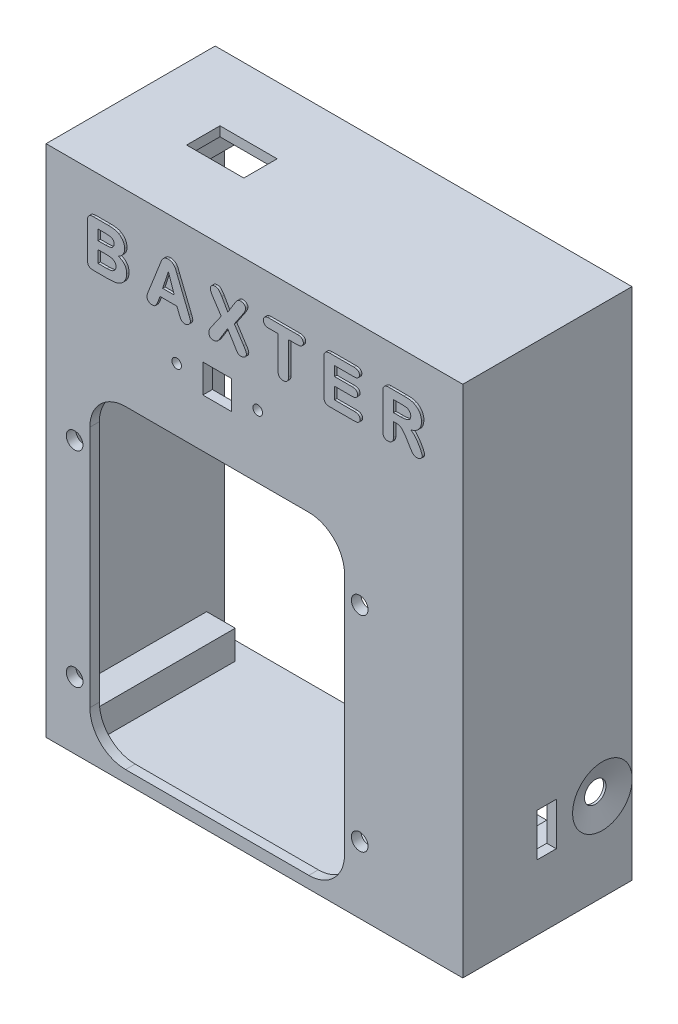
from build123d import *

# Parameters (mm, degrees)
SKETCH1_W           = 87.459125887
SKETCH1_H           = 107.911043217
SKETCH1_R           = 1.75
SKETCH1_R_2         = 1
SKETCH1_W_2         = 6
SKETCH1_H_2         = 6
BOSS_EXTRUDE1_DEPTH = 2
BOSS_EXTRUDE2_DEPTH = 0.5
SKETCH3_W           = 87.459125887
SKETCH3_H           = 107.911043217
SKETCH3_W_2         = 83.459125887
SKETCH3_H_2         = 103.911043217
BOSS_EXTRUDE3_DEPTH = 33.5
CUT_EXTRUDE1_REACH  = 126.747
SKETCH4_W           = 12
SKETCH4_H           = 7
CUT_EXTRUDE2_REACH  = 120.971
SKETCH5_W           = 4
SKETCH5_H           = 9
CUT_EXTRUDE3_REACH  = 119.509
SKETCH6_W           = 3.100406351
SKETCH6_H           = 3.267480843
CUT_EXTRUDE4_START  = -2
SKETCH7_R           = 2.252162883
CUT_EXTRUDE4_DEPTH  = 2
CHAMFER1_SIZE       = 1.5
CHAMFER1_SIZE_2     = 4
SKETCH8_W           = 6.466903759
SKETCH8_H           = 9.411043217
SKETCH8_R           = 1.5
SKETCH8_W_2         = 8
SKETCH8_H_2         = 8
SKETCH8_W_3         = 6
SKETCH8_H_3         = 6
BOSS_EXTRUDE4_DEPTH = 29.704377
CHAMFER2_SIZE       = 0.5


with BuildPart() as part:
    # Sketch1 → Boss-Extrude1 (new body)
    with BuildSketch(Plane.XY):
        with Locations((7.814562944, 18.465521609)):
            Rectangle(SKETCH1_W, SKETCH1_H)
        with Locations((-29.915, 21.5)):
            Circle(SKETCH1_R, mode=Mode.SUBTRACT)
        with Locations((-29.915, -21.5)):
            Circle(SKETCH1_R, mode=Mode.SUBTRACT)
        with Locations((29.915, -21.5)):
            Circle(SKETCH1_R, mode=Mode.SUBTRACT)
        with Locations((29.915, 21.5)):
            Circle(SKETCH1_R, mode=Mode.SUBTRACT)
        with Locations((8.5, 46.192098803)):
            Circle(SKETCH1_R_2, mode=Mode.SUBTRACT)
        with Locations((-8.5, 46.192098803)):
            Circle(SKETCH1_R_2, mode=Mode.SUBTRACT)
        with Locations((0, 46.192098803)):
            Rectangle(SKETCH1_W_2, SKETCH1_H_2, mode=Mode.SUBTRACT)
        with BuildLine():
            Line((-19.223311659, 32.99), (19.223311659, 32.99))
            ThreePointArc((19.223311659, 32.99), (24.526612518, 30.793300859), (26.723311659, 25.49))
            Line((26.723311659, 25.49), (26.723311659, -25.49))
            ThreePointArc((26.723311659, -25.49), (24.526612518, -30.793300859), (19.223311659, -32.99))
            Line((19.223311659, -32.99), (-19.223311659, -32.99))
            ThreePointArc((-19.223311659, -32.99), (-24.526612518, -30.793300859), (-26.723311659, -25.49))
            Line((-26.723311659, -25.49), (-26.723311659, 25.49))
            ThreePointArc((-26.723311659, 25.49), (-24.526612518, 30.793300859), (-19.223311659, 32.99))
        make_face(mode=Mode.SUBTRACT)
    extrude(amount=-BOSS_EXTRUDE1_DEPTH)

    # Sketch2 → Boss-Extrude2 (add)
    # profile 1 of 6: a face of its own
    with BuildSketch(Plane.XY):
        with BuildLine():
            Line((-22.527233932, 54.865073738), (-25.449108932, 54.865073738))
            add(Edge.make_bspline(
                [(-25.449108932, 54.865073738), (-25.504462753, 54.86651031), (-25.611432496, 54.869286445), (-25.766410869, 54.881712834), (-25.90933825, 54.907583848), (-26.040441654, 54.941783394), (-26.159295279, 54.987637572), (-26.266914842, 55.041221498), (-26.36189499, 55.106668517), (-26.473623858, 55.207124464), (-26.587002132, 55.366601638), (-26.682692574, 55.596581487), (-26.738187962, 55.869662535), (-26.744544319, 56.065325273), (-26.747937057, 56.169761238)],
                knots=[0, 0, 0, 0, 0.936955413, 1.810640645, 2.627471322, 3.391725116, 4.099592845, 4.779477373, 5.421161952, 6.045107732, 7.31426143, 8.691323709, 10.233977494, 12, 12, 12, 12], degree=3))
            Line((-26.747937057, 56.169761238), (-26.747937057, 63.310386238))
            add(Edge.make_bspline(
                [(-26.747937057, 63.310386238), (-26.746449444, 63.365079985), (-26.743558182, 63.471380532), (-26.731734098, 63.6251866), (-26.704428182, 63.766935954), (-26.673953366, 63.898231458), (-26.626631652, 64.016018594), (-26.576281463, 64.124941611), (-26.50948738, 64.218782667), (-26.437110862, 64.304692705), (-26.35268313, 64.379772969), (-26.255131133, 64.441176508), (-26.14926693, 64.498217682), (-26.029179426, 64.538588002), (-25.900582628, 64.575443514), (-25.759537082, 64.59705456), (-25.608384177, 64.614150788), (-25.503202956, 64.61476028), (-25.449108932, 64.615073738)],
                knots=[0, 0, 0, 0, 1.234281386, 2.398899174, 3.473276213, 4.488311567, 5.431895501, 6.33161106, 7.186973205, 8.019984934, 8.862648005, 9.722034222, 10.615255291, 11.567483617, 12.572055511, 13.629438883, 14.780835704, 16, 16, 16, 16], degree=3))
            Line((-25.449108932, 64.615073738), (-22.349499557, 64.615073738))
            add(Edge.make_bspline(
                [(-22.349499557, 64.615073738), (-22.233595609, 64.613950408), (-22.008157866, 64.611765488), (-21.68092858, 64.594908093), (-21.374649327, 64.563384617), (-21.089052601, 64.520700751), (-20.82125908, 64.466852852), (-20.574449843, 64.386672854), (-20.343350019, 64.293042834), (-20.202206593, 64.211747166), (-20.132702682, 64.171714363)],
                knots=[0, 0, 0, 0, 1.21529484, 2.363796318, 3.434321539, 4.442246558, 5.391526987, 6.293972514, 7.159892973, 8, 8, 8, 8], degree=3))
            add(Edge.make_bspline(
                [(-20.132702682, 64.171714363), (-20.06675251, 64.129947772), (-19.937704656, 64.048221087), (-19.761469092, 63.907127373), (-19.600176562, 63.760094436), (-19.459693943, 63.600053974), (-19.334216346, 63.434681158), (-19.226132115, 63.261242336), (-19.133934041, 63.081846225), (-19.059752571, 62.895160238), (-19.001582006, 62.704271864), (-18.957857023, 62.509899355), (-18.931668658, 62.311761208), (-18.928978037, 62.178302231), (-18.927624557, 62.111167488)],
                knots=[0, 0, 0, 0, 1.123942313, 2.199271674, 3.248046618, 4.264655283, 5.262745254, 6.236198248, 7.205302616, 8.165100739, 9.126501924, 10.077828096, 11.033077278, 12, 12, 12, 12], degree=3))
            add(Edge.make_bspline(
                [(-18.927624557, 62.111167488), (-18.931489245, 61.994315706), (-18.9390012, 61.767186089), (-19.004691021, 61.439964312), (-19.111911147, 61.139961084), (-19.2634151, 60.866734479), (-19.458079919, 60.620588957), (-19.698625232, 60.404983831), (-19.979552334, 60.214047875), (-20.189714457, 60.11543802), (-20.298718307, 60.064292488)],
                knots=[0, 0, 0, 0, 1.065910341, 2.071853786, 3.032604125, 3.963777757, 4.911515493, 5.883452176, 6.902219595, 8, 8, 8, 8], degree=3))
            add(Edge.make_bspline(
                [(-20.298718307, 60.064292488), (-20.225436378, 60.040565166), (-20.082424127, 59.994260466), (-19.878483622, 59.909254859), (-19.688265118, 59.81590001), (-19.512581481, 59.711862733), (-19.348712421, 59.600748824), (-19.200064013, 59.477939801), (-19.067489899, 59.343391167), (-18.944279865, 59.203409225), (-18.839546299, 59.050588815), (-18.748907148, 58.888098828), (-18.670495162, 58.717381001), (-18.608819666, 58.53562422), (-18.556629148, 58.345601851), (-18.522351202, 58.144775121), (-18.503205745, 57.934458723), (-18.499717675, 57.791545092), (-18.497937057, 57.718589363)],
                knots=[0, 0, 0, 0, 1.152771041, 2.249673079, 3.304543993, 4.322567291, 5.303956752, 6.266136403, 7.20345915, 8.12956584, 9.054235272, 9.970648562, 10.912823746, 11.862231084, 12.841051902, 13.860194419, 14.907654394, 16, 16, 16, 16], degree=3))
            add(Edge.make_bspline(
                [(-18.497937057, 57.718589363), (-18.502438125, 57.587304693), (-18.511321881, 57.328188274), (-18.5937821, 56.948471725), (-18.722375131, 56.584732045), (-18.872788728, 56.298699345), (-19.015528263, 56.081754222), (-19.136184426, 55.92864855), (-19.26779983, 55.78469889), (-19.411651045, 55.651855939), (-19.565096464, 55.526180653), (-19.732505281, 55.413222059), (-19.910341577, 55.30879879), (-20.035875174, 55.248931826), (-20.099499557, 55.218589363)],
                knots=[0, 0, 0, 0, 1.501722697, 2.963948569, 4.428396656, 5.909057848, 6.651412951, 7.400142878, 8.138895023, 8.882708842, 9.640735535, 10.407946348, 11.193097033, 12, 12, 12, 12], degree=3))
            add(Edge.make_bspline(
                [(-20.099499557, 55.218589363), (-20.17587196, 55.188001669), (-20.332990367, 55.125074623), (-20.584616509, 55.053162656), (-20.854664007, 54.989067439), (-21.146784499, 54.944114455), (-21.459626978, 54.909384243), (-21.795134794, 54.884268329), (-22.153388146, 54.868643261), (-22.400264204, 54.86628606), (-22.527233932, 54.865073738)],
                knots=[0, 0, 0, 0, 0.799241118, 1.644252195, 2.540778705, 3.495901808, 4.514873446, 5.600195434, 6.76576718, 8, 8, 8, 8], degree=3))
        make_face()
        with BuildLine():
            Line((-22.691296432, 59.115073738), (-24.497937057, 59.115073738))
            Line((-24.497937057, 59.115073738), (-24.497937057, 56.615073738))
            Line((-24.497937057, 56.615073738), (-22.624890182, 56.615073738))
            add(Edge.make_bspline(
                [(-22.624890182, 56.615073738), (-22.549354433, 56.61650222), (-22.402718688, 56.619275298), (-22.189394279, 56.631953125), (-21.991038434, 56.656919024), (-21.807518498, 56.693275718), (-21.637493949, 56.734093065), (-21.482853524, 56.789379335), (-21.342193771, 56.853545123), (-21.217652635, 56.929859148), (-21.10655651, 57.014483454), (-21.009938299, 57.108287327), (-20.928664697, 57.213623854), (-20.862440049, 57.328653095), (-20.811005173, 57.454187095), (-20.774167524, 57.58857383), (-20.752502045, 57.7335192), (-20.749493327, 57.833097654), (-20.747937057, 57.884604988)],
                knots=[0, 0, 0, 0, 1.410208712, 2.737604504, 3.987228427, 5.138423834, 6.22900769, 7.247607002, 8.199110638, 9.109930361, 9.967980757, 10.801585215, 11.615920747, 12.443479359, 13.271751538, 14.141512681, 15.038690372, 16, 16, 16, 16], degree=3))
            add(Edge.make_bspline(
                [(-20.747937057, 57.884604988), (-20.749516061, 57.936114627), (-20.752588472, 58.036341552), (-20.774147956, 58.181885651), (-20.810145663, 58.316959409), (-20.864465992, 58.43972075), (-20.930957167, 58.552733817), (-21.013574631, 58.654317932), (-21.110317587, 58.745642759), (-21.223479154, 58.823962615), (-21.351824778, 58.891930644), (-21.49522441, 58.953167627), (-21.655120744, 59.002782253), (-21.831437937, 59.043847993), (-22.023168389, 59.076575448), (-22.231833016, 59.099768561), (-22.456083298, 59.113430061), (-22.611198408, 59.11451401), (-22.691296432, 59.115073738)],
                knots=[0, 0, 0, 0, 0.945113246, 1.838991611, 2.694098804, 3.502080223, 4.295081212, 5.093732791, 5.896751785, 6.728758563, 7.610820383, 8.558422659, 9.586241637, 10.678828198, 11.879008116, 13.153602215, 14.530182924, 16, 16, 16, 16], degree=3))
        make_face(mode=Mode.SUBTRACT)
        with BuildLine():
            Line((-24.497937057, 62.865073738), (-24.497937057, 60.740073738))
            Line((-24.497937057, 60.740073738), (-22.937390182, 60.740073738))
            add(Edge.make_bspline(
                [(-22.937390182, 60.740073738), (-22.82407965, 60.74157142), (-22.612201887, 60.744371914), (-22.316507477, 60.764507192), (-22.0654701, 60.800283139), (-21.853530281, 60.851178318), (-21.674903174, 60.928188037), (-21.519857745, 61.027268384), (-21.389979453, 61.158055171), (-21.323047088, 61.260271699), (-21.288952682, 61.312339363)],
                knots=[0, 0, 0, 0, 1.481751764, 2.770706696, 3.872383118, 4.795388689, 5.611448465, 6.404856127, 7.187456108, 8, 8, 8, 8], degree=3))
            add(Edge.make_bspline(
                [(-21.288952682, 61.312339363), (-21.264253067, 61.352700413), (-21.215406557, 61.43251933), (-21.164850698, 61.562479005), (-21.134100174, 61.698262814), (-21.13058532, 61.790689392), (-21.128796432, 61.837729988)],
                knots=[0, 0, 0, 0, 1.017301494, 2.011838187, 2.988123119, 4, 4, 4, 4], degree=3))
            add(Edge.make_bspline(
                [(-21.128796432, 61.837729988), (-21.130376886, 61.886632056), (-21.133427631, 61.981027489), (-21.154404415, 62.116448034), (-21.191231104, 62.239090934), (-21.244683346, 62.34867851), (-21.314121425, 62.444886529), (-21.396572027, 62.530740286), (-21.496206068, 62.600717156), (-21.609779871, 62.660475771), (-21.740491539, 62.707837363), (-21.887029457, 62.751323611), (-22.051867956, 62.785304435), (-22.234331024, 62.814537503), (-22.434992216, 62.838047443), (-22.654014684, 62.852630558), (-22.890423528, 62.86265307), (-23.053915125, 62.864247981), (-23.138562057, 62.865073738)],
                knots=[0, 0, 0, 0, 0.914965722, 1.766154054, 2.556122555, 3.302526469, 4.036094969, 4.768347287, 5.518914996, 6.303605671, 7.163381131, 8.115545305, 9.162083192, 10.309672482, 11.572929144, 12.940815048, 14.416122767, 16, 16, 16, 16], degree=3))
            Line((-23.138562057, 62.865073738), (-24.497937057, 62.865073738))
        make_face(mode=Mode.SUBTRACT)
    # profile 2 of 6: a face of its own
    with BuildSketch(Plane.XY):
        with BuildLine():
            Line((-7.529187057, 56.027183113), (-7.951062057, 57.115073738))
            Line((-7.951062057, 57.115073738), (-11.497937057, 57.115073738))
            Line((-11.497937057, 57.115073738), (-11.917858932, 56.003745613))
            add(Edge.make_bspline(
                [(-11.917858932, 56.003745613), (-11.958565505, 55.899846956), (-12.034553992, 55.705895434), (-12.154869375, 55.440234712), (-12.273986436, 55.221900096), (-12.38826682, 55.038842755), (-12.532723979, 54.897068567), (-12.720939814, 54.802713669), (-12.951482386, 54.750109381), (-13.118733428, 54.743588313), (-13.208874557, 54.740073738)],
                knots=[0, 0, 0, 0, 1.356495851, 2.532221723, 3.54157171, 4.380081086, 5.146955799, 5.968218826, 6.904957208, 8, 8, 8, 8], degree=3))
            add(Edge.make_bspline(
                [(-13.208874557, 54.740073738), (-13.276299825, 54.743990062), (-13.408880164, 54.751690847), (-13.601510829, 54.808424651), (-13.778933751, 54.904457152), (-13.938999959, 55.03260546), (-14.07545585, 55.183970442), (-14.174408004, 55.35428037), (-14.237200305, 55.536575646), (-14.244337263, 55.662757358), (-14.247937057, 55.726401863)],
                knots=[0, 0, 0, 0, 1.022208542, 2.009999501, 3.017546279, 4.065023956, 5.107646554, 6.090287575, 7.036764522, 8, 8, 8, 8], degree=3))
            add(Edge.make_bspline(
                [(-14.247937057, 55.726401863), (-14.244445917, 55.799618094), (-14.237412577, 55.947121395), (-14.191521506, 56.131169859), (-14.138273423, 56.285977077), (-14.090394285, 56.422700941), (-14.028613257, 56.576046946), (-13.985512253, 56.684715256), (-13.962780807, 56.742026863)],
                knots=[0, 0, 0, 0, 1.240391658, 2.498924934, 3.197114154, 4.017672156, 4.954521381, 6, 6, 6, 6], degree=3))
            Line((-13.962780807, 56.742026863), (-11.550671432, 62.865073738))
            add(Edge.make_bspline(
                [(-11.550671432, 62.865073738), (-11.532437394, 62.911295723), (-11.493928329, 63.008913456), (-11.433737202, 63.161793698), (-11.3691821, 63.329580321), (-11.299003157, 63.506345375), (-11.225175364, 63.684208213), (-11.148028469, 63.852549598), (-11.065617982, 64.004690219), (-10.981101695, 64.144367758), (-10.887782011, 64.27262423), (-10.77384266, 64.38316381), (-10.64872765, 64.486056012), (-10.507580055, 64.576019403), (-10.35102247, 64.651475809), (-10.176492831, 64.703836647), (-9.986717775, 64.735279677), (-9.854833904, 64.738445434), (-9.786999557, 64.740073738)],
                knots=[0, 0, 0, 0, 0.853679882, 1.802914658, 2.822801742, 3.942336536, 5.070332533, 6.131226074, 7.12211866, 8.041015581, 8.935838438, 9.837486254, 10.759848543, 11.715519773, 12.706159806, 13.735753052, 14.835386677, 16, 16, 16, 16], degree=3))
            add(Edge.make_bspline(
                [(-9.786999557, 64.740073738), (-9.708733001, 64.73799665), (-9.557858606, 64.733992649), (-9.341881839, 64.698701148), (-9.145132542, 64.640285886), (-8.969652055, 64.557393145), (-8.813391773, 64.459485597), (-8.67619627, 64.351805509), (-8.556049039, 64.235718931), (-8.428104828, 64.067825008), (-8.29546042, 63.854709061), (-8.189881835, 63.632937255), (-8.116768078, 63.45008839), (-8.05898833, 63.299773346), (-7.993121225, 63.135205547), (-7.95014565, 63.019472796), (-7.927624557, 62.958823738)],
                knots=[0, 0, 0, 0, 1.173533508, 2.262219862, 3.272598696, 4.242658679, 5.164098679, 6.033602898, 6.855503607, 7.662469538, 9.193716809, 10.613499269, 11.340814752, 12.147957993, 13.029448424, 14, 14, 14, 14], degree=3))
            Line((-7.927624557, 62.958823738), (-5.431530807, 56.796714363))
            add(Edge.make_bspline(
                [(-5.431530807, 56.796714363), (-5.407266035, 56.736891186), (-5.361005507, 56.622838943), (-5.297307894, 56.457852401), (-5.24558794, 56.305529646), (-5.199330188, 56.167629001), (-5.165594484, 56.041656013), (-5.143411053, 55.929251668), (-5.124694744, 55.830524298), (-5.123495118, 55.768791573), (-5.122937057, 55.740073738)],
                knots=[0, 0, 0, 0, 1.400702844, 2.670424923, 3.83635414, 4.890572531, 5.825951907, 6.662580654, 7.377837464, 8, 8, 8, 8], degree=3))
            add(Edge.make_bspline(
                [(-5.122937057, 55.740073738), (-5.126590871, 55.682872737), (-5.134112356, 55.565122779), (-5.202179225, 55.393348448), (-5.306932291, 55.224038096), (-5.448297061, 55.062430269), (-5.622276991, 54.918886345), (-5.827553776, 54.813268412), (-6.0595949, 54.752169204), (-6.222177945, 54.744205527), (-6.306530807, 54.740073738)],
                knots=[0, 0, 0, 0, 0.801698477, 1.650320104, 2.562529297, 3.594246442, 4.655119759, 5.715558495, 6.814764618, 8, 8, 8, 8], degree=3))
            add(Edge.make_bspline(
                [(-6.306530807, 54.740073738), (-6.34828961, 54.740990233), (-6.428303225, 54.74274632), (-6.543823099, 54.76201026), (-6.650705859, 54.787372546), (-6.778622115, 54.840222141), (-6.919300896, 54.931981425), (-7.04146181, 55.049819669), (-7.122510491, 55.166894961), (-7.184642262, 55.271211107), (-7.24936594, 55.390055445), (-7.33136853, 55.565031488), (-7.425317144, 55.778818433), (-7.496202564, 55.948313468), (-7.529187057, 56.027183113)],
                knots=[0, 0, 0, 0, 0.783891859, 1.502007171, 2.196383546, 2.843907931, 4.092884444, 5.330059719, 6.005642055, 6.76311824, 7.611657834, 8.547445909, 10.393453153, 12, 12, 12, 12], degree=3))
        make_face()
        Polygon((-10.945202682, 58.865073738), (-8.501843307, 58.865073738), (-9.740124557, 62.490073738), align=None, mode=Mode.SUBTRACT)
    # profile 3 of 6: a face of its own
    with BuildSketch(Plane.XY):
        with BuildLine():
            Line((-0.755749557, 56.927573738), (1.341906693, 59.939292488))
            Line((1.341906693, 59.939292488), (-0.423718307, 62.609214363))
            add(Edge.make_bspline(
                [(-0.423718307, 62.609214363), (-0.463142875, 62.673450584), (-0.539022078, 62.79708398), (-0.642616041, 62.978801151), (-0.732966273, 63.14922003), (-0.810711328, 63.309006251), (-0.870891212, 63.464291365), (-0.913851955, 63.615854394), (-0.940972352, 63.765792006), (-0.943804961, 63.864965681), (-0.945202682, 63.913901863)],
                knots=[0, 0, 0, 0, 1.270645981, 2.445571597, 3.525775584, 4.522445372, 5.439738371, 6.329292819, 7.175607535, 8, 8, 8, 8], degree=3))
            add(Edge.make_bspline(
                [(-0.945202682, 63.913901863), (-0.941918722, 63.967098276), (-0.935384848, 64.07293962), (-0.879022923, 64.225317392), (-0.7885932, 64.366440007), (-0.665664292, 64.493291674), (-0.519293817, 64.601292629), (-0.354804242, 64.683828), (-0.174384558, 64.731320861), (-0.049639288, 64.737123602), (0.013781693, 64.740073738)],
                knots=[0, 0, 0, 0, 0.910760657, 1.812079554, 2.751460275, 3.77110047, 4.82607607, 5.860611187, 6.912326382, 8, 8, 8, 8], degree=3))
            add(Edge.make_bspline(
                [(0.013781693, 64.740073738), (0.09874315, 64.737144147), (0.259453279, 64.731602636), (0.483707614, 64.678837908), (0.67582992, 64.591691906), (0.833146001, 64.458294413), (0.974080172, 64.289350283), (1.129512895, 64.090441941), (1.294027719, 63.848940176), (1.405589635, 63.673351249), (1.464953568, 63.579917488)],
                knots=[0, 0, 0, 0, 1.033405907, 1.954754592, 2.788379049, 3.57735367, 4.442737392, 5.465868309, 6.651546774, 8, 8, 8, 8], degree=3))
            Line((1.464953568, 63.579917488), (2.732531693, 61.365073738))
            Line((2.732531693, 61.365073738), (4.088000443, 63.581870613))
            add(Edge.make_bspline(
                [(4.088000443, 63.581870613), (4.14687883, 63.671530539), (4.255916588, 63.837573089), (4.404762191, 64.073143777), (4.540182654, 64.272273338), (4.6740411, 64.439160289), (4.821380951, 64.57117415), (4.990631302, 64.667099337), (5.183811514, 64.731079054), (5.322487461, 64.736995427), (5.394641068, 64.740073738)],
                knots=[0, 0, 0, 0, 1.39911097, 2.591034385, 3.63459599, 4.539234147, 5.375652379, 6.197238629, 7.062016597, 8, 8, 8, 8], degree=3))
            add(Edge.make_bspline(
                [(5.394641068, 64.740073738), (5.473110698, 64.736996661), (5.62274995, 64.731128768), (5.834340462, 64.678591132), (6.022417843, 64.595845843), (6.177323842, 64.47417861), (6.30318285, 64.338345094), (6.395217207, 64.193527042), (6.455254639, 64.043432649), (6.461741574, 63.939816563), (6.464953568, 63.888511238)],
                knots=[0, 0, 0, 0, 1.242880165, 2.370135562, 3.437756896, 4.476819448, 5.471024873, 6.362198512, 7.189045438, 8, 8, 8, 8], degree=3))
            add(Edge.make_bspline(
                [(6.464953568, 63.888511238), (6.463373309, 63.849988821), (6.460021675, 63.768285103), (6.432807664, 63.641155864), (6.388049845, 63.503483021), (6.330253307, 63.353388072), (6.252173198, 63.192428631), (6.158824628, 63.019847529), (6.048990285, 62.835242038), (5.966802302, 62.711079516), (5.923937943, 62.646323738)],
                knots=[0, 0, 0, 0, 0.673867648, 1.429232577, 2.265373185, 3.207057523, 4.2417758, 5.394056927, 6.640895257, 8, 8, 8, 8], degree=3))
            Line((5.923937943, 62.646323738), (4.101672318, 59.933433113))
            Line((4.101672318, 59.933433113), (6.066516068, 56.923667488))
            add(Edge.make_bspline(
                [(6.066516068, 56.923667488), (6.114236185, 56.85153924), (6.20391441, 56.715991932), (6.326885816, 56.523718112), (6.421745236, 56.351074789), (6.499546341, 56.200462353), (6.554917641, 56.062097346), (6.598212266, 55.932346804), (6.621955351, 55.805406185), (6.625395916, 55.721927306), (6.627062943, 55.681479988)],
                knots=[0, 0, 0, 0, 1.502630552, 2.823824664, 3.963040165, 4.924095643, 5.766325504, 6.549691506, 7.297294242, 8, 8, 8, 8], degree=3))
            add(Edge.make_bspline(
                [(6.627062943, 55.681479988), (6.625564627, 55.643598397), (6.622565116, 55.567762435), (6.597944377, 55.45538179), (6.55849552, 55.345148907), (6.503788091, 55.237931324), (6.433836123, 55.135272231), (6.343097881, 55.042273488), (6.236086883, 54.957147245), (6.11320797, 54.881017579), (5.976974619, 54.818552813), (5.828568827, 54.773514457), (5.669758914, 54.745788231), (5.560119943, 54.742008091), (5.504016068, 54.740073738)],
                knots=[0, 0, 0, 0, 0.836340742, 1.674288289, 2.529711503, 3.417542677, 4.327361462, 5.263414227, 6.276647674, 7.342534455, 8.449750648, 9.578256069, 10.760758013, 12, 12, 12, 12], degree=3))
            add(Edge.make_bspline(
                [(5.504016068, 54.740073738), (5.454441977, 54.741478031), (5.3586055, 54.744192807), (5.221255647, 54.767623701), (5.095689192, 54.807075565), (4.947954972, 54.878635955), (4.79180002, 54.996644171), (4.662340779, 55.142158457), (4.569092084, 55.282685295), (4.486602562, 55.419463828), (4.386230565, 55.585689133), (4.315655129, 55.70739764), (4.277453568, 55.773276863)],
                knots=[0, 0, 0, 0, 0.871406904, 1.684601078, 2.441430038, 3.178869024, 4.562050012, 5.851437557, 6.585044276, 7.525690754, 8.660688763, 10, 10, 10, 10], degree=3))
            Line((4.277453568, 55.773276863), (2.691516068, 58.365073738))
            Line((2.691516068, 58.365073738), (1.080187943, 55.751792488))
            add(Edge.make_bspline(
                [(1.080187943, 55.751792488), (1.048468967, 55.702844022), (0.990727618, 55.613738045), (0.909604414, 55.493984148), (0.845992447, 55.399462679), (0.780926627, 55.302650113), (0.693625521, 55.192492662), (0.567647703, 55.059935008), (0.405843012, 54.927652563), (0.238666867, 54.842394831), (0.089028242, 54.78726023), (-0.038089823, 54.761548508), (-0.173824179, 54.743070609), (-0.268048994, 54.741088611), (-0.316296432, 54.740073738)],
                knots=[0, 0, 0, 0, 1.150745118, 2.094820893, 2.853647022, 3.398759872, 4.395789558, 5.622255636, 7.002406406, 8.496226168, 9.300647091, 10.142157361, 11.048699162, 12, 12, 12, 12], degree=3))
            add(Edge.make_bspline(
                [(-0.316296432, 54.740073738), (-0.380361463, 54.743067538), (-0.504951239, 54.7488897), (-0.68372994, 54.794388144), (-0.845151133, 54.871926982), (-0.987254801, 54.979859713), (-1.104390505, 55.118581889), (-1.190011011, 55.28656462), (-1.238174643, 55.482908897), (-1.244570847, 55.621967687), (-1.247937057, 55.695151863)],
                knots=[0, 0, 0, 0, 1.020064409, 1.983759193, 2.916409198, 3.856358439, 4.806103829, 5.785089276, 6.834331751, 8, 8, 8, 8], degree=3))
            add(Edge.make_bspline(
                [(-1.247937057, 55.695151863), (-1.246364625, 55.738877387), (-1.243105257, 55.829512542), (-1.217454265, 55.967808115), (-1.181534864, 56.113591824), (-1.124223287, 56.263790599), (-1.057263617, 56.422898123), (-0.969521272, 56.585787786), (-0.870586517, 56.756737966), (-0.794848271, 56.869409023), (-0.755749557, 56.927573738)],
                knots=[0, 0, 0, 0, 0.779340777, 1.615433383, 2.50253802, 3.453883647, 4.478443189, 5.579496004, 6.750451742, 8, 8, 8, 8], degree=3))
        make_face()
    # profile 4 of 6: a face of its own
    with BuildSketch(Plane.XY):
        with BuildLine():
            Line((17.349719193, 62.740073738), (15.502062943, 62.740073738))
            Line((15.502062943, 62.740073738), (15.502062943, 56.027183113))
            add(Edge.make_bspline(
                [(15.502062943, 56.027183113), (15.498832631, 55.931751837), (15.492678821, 55.749953384), (15.432317524, 55.493788956), (15.337971114, 55.267153623), (15.198369282, 55.078089579), (15.026930626, 54.922489942), (14.817278448, 54.817554276), (14.579100041, 54.750298327), (14.409465995, 54.74359331), (14.320422318, 54.740073738)],
                knots=[0, 0, 0, 0, 1.154502642, 2.199350185, 3.171019621, 4.108326009, 5.024885088, 5.949354719, 6.923582868, 8, 8, 8, 8], degree=3))
            add(Edge.make_bspline(
                [(14.320422318, 54.740073738), (14.244407189, 54.743188163), (14.096726622, 54.749238803), (13.887714702, 54.814706389), (13.700955337, 54.918476641), (13.539025759, 55.062766994), (13.406750393, 55.248775461), (13.317811324, 55.476093906), (13.259002724, 55.739063278), (13.254471087, 55.927203866), (13.252062943, 56.027183113)],
                knots=[0, 0, 0, 0, 0.961939855, 1.868836178, 2.749149873, 3.656196718, 4.598384172, 5.617152304, 6.733737787, 8, 8, 8, 8], degree=3))
            Line((13.252062943, 56.027183113), (13.252062943, 62.740073738))
            Line((13.252062943, 62.740073738), (11.281359818, 62.740073738))
            add(Edge.make_bspline(
                [(11.281359818, 62.740073738), (11.196452796, 62.742537408), (11.035463415, 62.747208692), (10.81059083, 62.795969063), (10.616699623, 62.875927329), (10.458474437, 62.990678853), (10.334534589, 63.131902011), (10.247707535, 63.295220258), (10.194977426, 63.478408248), (10.188844068, 63.606895441), (10.185656693, 63.673667488)],
                knots=[0, 0, 0, 0, 1.248592244, 2.367414245, 3.368128247, 4.315390838, 5.219009553, 6.111113472, 7.018386057, 8, 8, 8, 8], degree=3))
            add(Edge.make_bspline(
                [(10.185656693, 63.673667488), (10.188468839, 63.743114453), (10.193873729, 63.876590186), (10.251229589, 64.064931067), (10.341491998, 64.230751682), (10.469888764, 64.370215993), (10.631257725, 64.480106076), (10.822087231, 64.560980243), (11.042860884, 64.607225962), (11.199104567, 64.61236714), (11.281359818, 64.615073738)],
                knots=[0, 0, 0, 0, 1.016926431, 1.954513078, 2.861635154, 3.768303807, 4.709635271, 5.707513053, 6.793109035, 8, 8, 8, 8], degree=3))
            Line((11.281359818, 64.615073738), (17.349719193, 64.615073738))
            add(Edge.make_bspline(
                [(17.349719193, 64.615073738), (17.448331366, 64.612280802), (17.632861397, 64.607054464), (17.88972932, 64.554018222), (18.108128483, 64.468673835), (18.281009964, 64.341458941), (18.414620814, 64.194871158), (18.51136761, 64.032898062), (18.57087217, 63.857390853), (18.578359766, 63.735316239), (18.582141068, 63.673667488)],
                knots=[0, 0, 0, 0, 1.358217745, 2.541592552, 3.600415931, 4.564883607, 5.473882086, 6.319281183, 7.151222243, 8, 8, 8, 8], degree=3))
            add(Edge.make_bspline(
                [(18.582141068, 63.673667488), (18.578414379, 63.612007199), (18.571072346, 63.490528897), (18.511107319, 63.315421366), (18.412951825, 63.154549296), (18.276803699, 63.009677742), (18.102393592, 62.884854031), (17.884072237, 62.80185662), (17.62967721, 62.748007362), (17.447049618, 62.742831948), (17.349719193, 62.740073738)],
                knots=[0, 0, 0, 0, 0.852235862, 1.679008743, 2.532483527, 3.44465099, 4.415144126, 5.474873821, 6.654247145, 8, 8, 8, 8], degree=3))
        make_face()
    # profile 5 of 6: a face of its own
    with BuildSketch(Plane.XY):
        with BuildLine():
            Line((29.205187943, 62.865073738), (25.127062943, 62.865073738))
            Line((25.127062943, 62.865073738), (25.127062943, 60.865073738))
            Line((25.127062943, 60.865073738), (28.861437943, 60.865073738))
            add(Edge.make_bspline(
                [(28.861437943, 60.865073738), (28.950897924, 60.862675449), (29.118987424, 60.858169221), (29.353169448, 60.809609387), (29.552489428, 60.728831111), (29.710206574, 60.61075824), (29.832306574, 60.474559927), (29.923519675, 60.326507714), (29.975977391, 60.164052497), (29.982932185, 60.05227679), (29.986437943, 59.995933113)],
                knots=[0, 0, 0, 0, 1.344495747, 2.526220279, 3.579812361, 4.553680436, 5.462494663, 6.319395164, 7.152844041, 8, 8, 8, 8], degree=3))
            add(Edge.make_bspline(
                [(29.986437943, 59.995933113), (29.98294189, 59.939567515), (29.975967832, 59.827127303), (29.922967024, 59.664527714), (29.836285838, 59.512895838), (29.717449988, 59.373389132), (29.559433819, 59.255308573), (29.36035375, 59.171159285), (29.122662252, 59.124731132), (28.952140744, 59.118426997), (28.861437943, 59.115073738)],
                knots=[0, 0, 0, 0, 0.841735369, 1.679125322, 2.52915054, 3.440350119, 4.400169896, 5.450860501, 6.644076661, 8, 8, 8, 8], degree=3))
            Line((28.861437943, 59.115073738), (25.127062943, 59.115073738))
            Line((25.127062943, 59.115073738), (25.127062943, 56.615073738))
            Line((25.127062943, 56.615073738), (29.353625443, 56.615073738))
            add(Edge.make_bspline(
                [(29.353625443, 56.615073738), (29.444421152, 56.612865352), (29.615925361, 56.608693927), (29.854792893, 56.557193295), (30.060150565, 56.476418638), (30.22580187, 56.359522261), (30.353658095, 56.221251934), (30.44838988, 56.070850432), (30.506459945, 55.90626989), (30.512621959, 55.791960127), (30.515734818, 55.734214363)],
                knots=[0, 0, 0, 0, 1.332437373, 2.51684381, 3.572502442, 4.554866338, 5.469043441, 6.324211287, 7.153443252, 8, 8, 8, 8], degree=3))
            add(Edge.make_bspline(
                [(30.515734818, 55.734214363), (30.512679998, 55.677724612), (30.506630809, 55.565862998), (30.44752898, 55.405430144), (30.355432224, 55.255969078), (30.22773824, 55.119589664), (30.063881462, 55.000192443), (29.856598602, 54.924158058), (29.617389384, 54.870979019), (29.445128377, 54.867122352), (29.353625443, 54.865073738)],
                knots=[0, 0, 0, 0, 0.832019265, 1.647573513, 2.494153945, 3.413303389, 4.393152201, 5.459860401, 6.650708996, 8, 8, 8, 8], degree=3))
            Line((29.353625443, 54.865073738), (24.150500443, 54.865073738))
            add(Edge.make_bspline(
                [(24.150500443, 54.865073738), (24.096450639, 54.866500023), (23.992732398, 54.869236978), (23.842255022, 54.881669293), (23.704232941, 54.908169627), (23.575853573, 54.939646662), (23.459759342, 54.985693347), (23.354693723, 55.039490199), (23.260356279, 55.103158246), (23.178062462, 55.17741232), (23.107031674, 55.263645618), (23.043464278, 55.358998647), (22.994194941, 55.468009506), (22.949807242, 55.586285541), (22.917621969, 55.716817168), (22.895113367, 55.857983448), (22.877876938, 56.009841495), (22.877341581, 56.115019318), (22.877062943, 56.169761238)],
                knots=[0, 0, 0, 0, 1.231237759, 2.362669336, 3.432707315, 4.428711373, 5.367466922, 6.269206627, 7.112120463, 7.951768952, 8.783131882, 9.650714053, 10.552575606, 11.499953392, 12.524669123, 13.606756769, 14.754388293, 16, 16, 16, 16], degree=3))
            Line((22.877062943, 56.169761238), (22.877062943, 63.310386238))
            add(Edge.make_bspline(
                [(22.877062943, 63.310386238), (22.87822496, 63.381439128), (22.880450731, 63.517536522), (22.906471644, 63.711788732), (22.946725822, 63.887630916), (23.004242331, 64.045908952), (23.084136538, 64.184092824), (23.179503215, 64.306511018), (23.299506267, 64.404302769), (23.436851654, 64.483556294), (23.592535764, 64.543579002), (23.764546331, 64.585532521), (23.952439905, 64.611590837), (24.082701521, 64.613881491), (24.150500443, 64.615073738)],
                knots=[0, 0, 0, 0, 1.214099802, 2.325532672, 3.34339898, 4.294435266, 5.191848223, 6.062776357, 6.932138201, 7.819903888, 8.764534936, 9.774212717, 10.841516152, 12, 12, 12, 12], degree=3))
            Line((24.150500443, 64.615073738), (29.205187943, 64.615073738))
            add(Edge.make_bspline(
                [(29.205187943, 64.615073738), (29.297906947, 64.612752177), (29.471173978, 64.608413799), (29.71233434, 64.55947958), (29.916971639, 64.479301004), (30.079018073, 64.361408879), (30.203272403, 64.224600248), (30.29631267, 64.076680839), (30.351670858, 63.913767091), (30.358156199, 63.80102852), (30.361437943, 63.743979988)],
                knots=[0, 0, 0, 0, 1.368581966, 2.557513838, 3.618974591, 4.591051988, 5.490138458, 6.336766939, 7.158362538, 8, 8, 8, 8], degree=3))
            add(Edge.make_bspline(
                [(30.361437943, 63.743979988), (30.358212387, 63.685630366), (30.35187389, 63.570968307), (30.296400136, 63.405455345), (30.203220036, 63.255807722), (30.080278595, 63.116623325), (29.916171609, 63.001289683), (29.712473687, 62.920485627), (29.471131048, 62.87178983), (29.297891982, 62.867414873), (29.205187943, 62.865073738)],
                knots=[0, 0, 0, 0, 0.8567094, 1.683508165, 2.534308784, 3.436236195, 4.398151413, 5.454589036, 6.637894548, 8, 8, 8, 8], degree=3))
        make_face()
    # profile 6 of 6: a face of its own
    with BuildSketch(Plane.XY):
        with BuildLine():
            Line((37.949328568, 58.865073738), (37.502062943, 58.865073738))
            Line((37.502062943, 58.865073738), (37.502062943, 56.009604988))
            add(Edge.make_bspline(
                [(37.502062943, 56.009604988), (37.498848734, 55.914833997), (37.492748697, 55.734974355), (37.432482481, 55.480913793), (37.335959167, 55.258231976), (37.196518824, 55.070856922), (37.022068785, 54.922250699), (36.814984373, 54.813849687), (36.575916938, 54.751586538), (36.406729558, 54.744020651), (36.318469193, 54.740073738)],
                knots=[0, 0, 0, 0, 1.15437857, 2.190819295, 3.164982136, 4.095832854, 5.014164094, 5.9378377, 6.92422712, 8, 8, 8, 8], degree=3))
            add(Edge.make_bspline(
                [(36.318469193, 54.740073738), (36.237943506, 54.743905376), (36.08396709, 54.751232005), (35.866464139, 54.815214575), (35.678309609, 54.922812689), (35.520865601, 55.072790969), (35.398147541, 55.263021856), (35.314255492, 55.489748666), (35.260263193, 55.749936536), (35.254900312, 55.935084978), (35.252062943, 56.033042488)],
                knots=[0, 0, 0, 0, 1.015204484, 1.941213447, 2.832412049, 3.727922745, 4.660513285, 5.665077251, 6.764649513, 8, 8, 8, 8], degree=3))
            Line((35.252062943, 56.033042488), (35.252062943, 63.314292488))
            add(Edge.make_bspline(
                [(35.252062943, 63.314292488), (35.253524329, 63.36834302), (35.256363684, 63.473358885), (35.268532923, 63.625118037), (35.294666316, 63.765440175), (35.329608776, 63.894912266), (35.373645616, 64.013836314), (35.429067167, 64.121662843), (35.495644315, 64.216737307), (35.570826421, 64.302841719), (35.656960608, 64.377095845), (35.755229591, 64.44063536), (35.864129728, 64.494499443), (35.983581081, 64.540120001), (36.114990029, 64.572270776), (36.256359118, 64.598411004), (36.410053385, 64.610858105), (36.515720804, 64.613635794), (36.570422318, 64.615073738)],
                knots=[0, 0, 0, 0, 1.214535223, 2.359744881, 3.415267104, 4.415661951, 5.368991347, 6.25849837, 7.130646898, 7.969806146, 8.819978287, 9.675791146, 10.591361144, 11.544690539, 12.541337574, 13.625641143, 14.770850801, 16, 16, 16, 16], degree=3))
            Line((36.570422318, 64.615073738), (39.734484818, 64.615073738))
            add(Edge.make_bspline(
                [(39.734484818, 64.615073738), (39.842563242, 64.614304076), (40.051626518, 64.612815269), (40.355919209, 64.601946107), (40.640350291, 64.579153263), (40.907286206, 64.554018383), (41.155696822, 64.514553859), (41.386766233, 64.465425196), (41.599392219, 64.399406898), (41.731027362, 64.342138048), (41.795031693, 64.314292488)],
                knots=[0, 0, 0, 0, 1.236547625, 2.391936223, 3.482505465, 4.500860294, 5.458483211, 6.358493903, 7.201858281, 8, 8, 8, 8], degree=3))
            add(Edge.make_bspline(
                [(41.795031693, 64.314292488), (41.879343374, 64.2744296), (42.045215047, 64.196004834), (42.274043477, 64.048840735), (42.485146937, 63.887462345), (42.672470237, 63.704121514), (42.839781794, 63.50795107), (42.986400755, 63.299427968), (43.107672256, 63.077803784), (43.204899653, 62.844904811), (43.280640141, 62.603416355), (43.33869794, 62.356337316), (43.369339567, 62.101520481), (43.37446804, 61.930249171), (43.377062943, 61.843589363)],
                knots=[0, 0, 0, 0, 1.078063506, 2.120942165, 3.141071774, 4.147959111, 5.147265549, 6.121118943, 7.092083554, 8.064449859, 9.03649512, 10.017836902, 10.997065685, 12, 12, 12, 12], degree=3))
            add(Edge.make_bspline(
                [(43.377062943, 61.843589363), (43.375275292, 61.754966399), (43.371781728, 61.5817727), (43.341889464, 61.328214796), (43.292895795, 61.088022868), (43.227514379, 60.858937195), (43.137949459, 60.644161007), (43.033758177, 60.43900381), (42.904728339, 60.249625358), (42.760447298, 60.071146735), (42.598157087, 59.906936469), (42.419196322, 59.758716146), (42.226589736, 59.622332087), (42.017765067, 59.502049137), (41.794370685, 59.396258762), (41.555787473, 59.306269679), (41.302492867, 59.230106488), (41.126696032, 59.191410033), (41.037219193, 59.171714363)],
                knots=[0, 0, 0, 0, 1.091673494, 2.133430904, 3.140260493, 4.109911342, 5.063266626, 6.003265747, 6.939904656, 7.880759052, 8.828020384, 9.779078098, 10.740498569, 11.732487655, 12.744353496, 13.782739163, 14.871461545, 16, 16, 16, 16], degree=3))
            add(Edge.make_bspline(
                [(41.037219193, 59.171714363), (41.114025944, 59.140349257), (41.274622452, 59.074767437), (41.502342784, 58.919139739), (41.732915163, 58.721497294), (41.957575735, 58.477753571), (42.178984365, 58.21030939), (42.395838387, 57.931236442), (42.595485117, 57.639561176), (42.783465866, 57.344621386), (42.95105431, 57.052638307), (43.106816648, 56.777656105), (43.233805953, 56.515963372), (43.343052094, 56.275866183), (43.430333497, 56.06288425), (43.493080092, 55.883222816), (43.535403919, 55.740011238), (43.542169184, 55.65496474), (43.545031693, 55.618979988)],
                knots=[0, 0, 0, 0, 0.889723049, 1.860336685, 2.947432501, 4.150543113, 5.417666083, 6.680374247, 7.948134929, 9.216050159, 10.439269186, 11.567059413, 12.612509767, 13.564781371, 14.403081584, 15.084825861, 15.612772825, 16, 16, 16, 16], degree=3))
            add(Edge.make_bspline(
                [(43.545031693, 55.618979988), (43.543587233, 55.586921596), (43.540624878, 55.521175014), (43.51333664, 55.422289021), (43.469113557, 55.321607978), (43.409309201, 55.219656222), (43.333321931, 55.119261809), (43.238835956, 55.027705166), (43.128439802, 54.945213618), (43.003058028, 54.873724987), (42.865389652, 54.81138029), (42.713141712, 54.773222363), (42.551445642, 54.742717536), (42.439078156, 54.740974908), (42.380969193, 54.740073738)],
                knots=[0, 0, 0, 0, 0.717152191, 1.4707633, 2.280978877, 3.17663991, 4.113181349, 5.093135307, 6.114241816, 7.192612537, 8.322723271, 9.486963819, 10.700425459, 12, 12, 12, 12], degree=3))
            add(Edge.make_bspline(
                [(42.380969193, 54.740073738), (42.323520826, 54.741656986), (42.212258893, 54.744723309), (42.052232742, 54.776700432), (41.906332973, 54.828968757), (41.734893567, 54.926974352), (41.548755534, 55.083180927), (41.39232236, 55.273247551), (41.278217315, 55.451321466), (41.176193137, 55.609225825), (41.061200031, 55.79299027), (40.980481621, 55.924259326), (40.937609818, 55.993979988)],
                knots=[0, 0, 0, 0, 0.85212187, 1.650329359, 2.411864667, 3.143352146, 4.571805004, 5.99281223, 6.781122741, 7.711677347, 8.784607922, 10, 10, 10, 10], degree=3))
            Line((40.937609818, 55.993979988), (40.177844193, 57.247886238))
            add(Edge.make_bspline(
                [(40.177844193, 57.247886238), (40.109552231, 57.355121474), (39.980721729, 57.557417161), (39.787964966, 57.836083104), (39.60599591, 58.070783447), (39.437365201, 58.268691851), (39.272365844, 58.428915821), (39.1123386, 58.563815273), (38.94701555, 58.664362503), (38.780148345, 58.744769945), (38.60080563, 58.79928432), (38.403882004, 58.837920525), (38.184253036, 58.8611321), (38.030116286, 58.863718256), (37.949328568, 58.865073738)],
                knots=[0, 0, 0, 0, 1.566699848, 2.955526845, 4.173582278, 5.225707313, 6.156176833, 7.005752216, 7.798373843, 8.534138643, 9.282696541, 10.100893157, 11.004620857, 12, 12, 12, 12], degree=3))
        make_face()
        with BuildLine():
            Line((39.091906693, 62.865073738), (37.502062943, 62.865073738))
            Line((37.502062943, 62.865073738), (37.502062943, 60.490073738))
            Line((37.502062943, 60.490073738), (39.037219193, 60.490073738))
            add(Edge.make_bspline(
                [(39.037219193, 60.490073738), (39.149234078, 60.491588606), (39.363718054, 60.494489248), (39.670830682, 60.51583741), (39.948088633, 60.550255079), (40.196418238, 60.597260146), (40.41528817, 60.663656724), (40.606235509, 60.746077768), (40.767509416, 60.848600528), (40.901165958, 60.970096032), (41.004726626, 61.115704462), (41.077904971, 61.286604296), (41.120539797, 61.482130592), (41.124822727, 61.620712492), (41.127062943, 61.693198738)],
                knots=[0, 0, 0, 0, 1.470156845, 2.815028431, 4.03814429, 5.135817202, 6.127823499, 7.03449181, 7.857000559, 8.624968086, 9.390840978, 10.183005685, 11.049608235, 12, 12, 12, 12], degree=3))
            add(Edge.make_bspline(
                [(41.127062943, 61.693198738), (41.124965536, 61.751339404), (41.120871184, 61.864835891), (41.084208622, 62.029453199), (41.025860012, 62.183362726), (40.942695119, 62.324194898), (40.840705663, 62.45243813), (40.718373059, 62.564632019), (40.576640731, 62.65953766), (40.47160075, 62.706419759), (40.418078568, 62.730308113)],
                knots=[0, 0, 0, 0, 1.041851235, 2.033799445, 3.00987435, 3.983430348, 4.955654292, 5.939316558, 6.949997205, 8, 8, 8, 8], degree=3))
            add(Edge.make_bspline(
                [(40.418078568, 62.730308113), (40.386994682, 62.741276262), (40.319255196, 62.765178576), (40.20461939, 62.791415178), (40.070261687, 62.81421739), (39.915247544, 62.834255697), (39.739113333, 62.84602612), (39.541948756, 62.859131931), (39.323698022, 62.863821789), (39.171332678, 62.864644743), (39.091906693, 62.865073738)],
                knots=[0, 0, 0, 0, 0.590543186, 1.286939845, 2.104370999, 3.03378788, 4.087407475, 5.268320823, 6.576012755, 8, 8, 8, 8], degree=3))
        make_face(mode=Mode.SUBTRACT)
    extrude(amount=BOSS_EXTRUDE2_DEPTH)

    # Sketch3 → Boss-Extrude3 (add)
    with BuildSketch(Plane(origin=(0, 0, -2), x_dir=(-1, 0, 0), z_dir=(0, 0, -1))):
        with Locations((-7.814562944, 18.465521609)):
            Rectangle(SKETCH3_W, SKETCH3_H)
        with Locations((-7.814562944, 18.465521609)):
            Rectangle(SKETCH3_W_2, SKETCH3_H_2, mode=Mode.SUBTRACT)
    extrude(amount=BOSS_EXTRUDE3_DEPTH)

    # Sketch4 → Cut-Extrude1 (cut, up to next)
    with BuildSketch(Plane(origin=(0, 72.421043217, 0), x_dir=(1, 0, 0), z_dir=(0, 1, 0)), mode=Mode.PRIVATE) as cut_extrude1_sk1:
        with Locations((-14.915, 18)):
            Rectangle(SKETCH4_W, SKETCH4_H)
    cut_extrude1_tool1 = extrude(cut_extrude1_sk1.sketch, amount=-CUT_EXTRUDE1_REACH, mode=Mode.PRIVATE) & part.part
    add(cut_extrude1_tool1.solids().sort_by_distance((-14.915, 72.421043, -18))[0], mode=Mode.SUBTRACT)

    # Sketch5 → Cut-Extrude2 (cut, up to next)
    with BuildSketch(Plane(origin=(51.544125887, 0, 0), x_dir=(0, 0, -1), z_dir=(1, 0, 0)), mode=Mode.PRIVATE) as cut_extrude2_sk1:
        with Locations((17.623763905, -17.310837054)):
            Rectangle(SKETCH5_W, SKETCH5_H)
    cut_extrude2_tool1 = extrude(cut_extrude2_sk1.sketch, amount=-CUT_EXTRUDE2_REACH, mode=Mode.PRIVATE) & part.part
    add(cut_extrude2_tool1.solids().sort_by_distance((51.544126, -17.310837, -17.623764))[0], mode=Mode.SUBTRACT)

    # Sketch6 → Cut-Extrude3 (cut, up to next)
    with BuildSketch(Plane.ZY.offset(-49.544125887), mode=Mode.PRIVATE) as cut_extrude3_sk1:
        with Locations((-29.299510977, -17.06923413)):
            Rectangle(SKETCH6_W, SKETCH6_H)
    cut_extrude3_tool1 = extrude(cut_extrude3_sk1.sketch, amount=-CUT_EXTRUDE3_REACH, mode=Mode.PRIVATE) & part.part
    add(cut_extrude3_tool1.solids().sort_by_distance((49.544126, -17.069234, -29.299511))[0], mode=Mode.SUBTRACT)

    # Sketch7 → Cut-Extrude4 (cut)
    with BuildSketch(Plane(origin=(51.544125887, 0, 0), x_dir=(0, 0, -1), z_dir=(1, 0, 0)).offset(CUT_EXTRUDE4_START)):
        with Locations((29.299510978, -17.06923413)):
            Circle(SKETCH7_R)
    extrude(amount=CUT_EXTRUDE4_DEPTH, mode=Mode.SUBTRACT)

    # Chamfer1
    # the kernel refuses this chamfer: 4, 1.5 mm, written as the material it takes off along each edge
    with BuildSketch(Plane(origin=(51.544125887, -17.06923413, -29.299510978), x_dir=(0, 0, -1), z_dir=(0, 1, 0))) as chamfer1_piece_1:
        Polygon((2.252162883, CHAMFER1_SIZE), (2.252162883 + CHAMFER1_SIZE_2, 0), (2.252162883, 0), align=None)
    revolve(axis=Axis((51.544125887, -17.06923413, -29.299510978), (-1, 0, 0)), mode=Mode.SUBTRACT)

    # Sketch8 → Boss-Extrude4 (add)
    # profile 1 of 4: a face of its own
    with BuildSketch(Plane(origin=(0, 0, -2), x_dir=(-1, 0, 0), z_dir=(0, 0, -1))):
        with Locations((-46.310674007, -28.784478392)):
            Rectangle(SKETCH8_W, SKETCH8_H)
        with Locations(Location((-46.577222128, -27.578956783, 0), (0, 0, 180))):
            Circle(SKETCH8_R, mode=Mode.SUBTRACT)
    # profile 2 of 4: a face of its own
    with BuildSketch(Plane(origin=(0, 0, -2), x_dir=(-1, 0, 0), z_dir=(0, 0, -1))):
        with BuildLine():
            Line((-49.544125887, 70.421043217), (-43.077222128, 70.421043217))
            Line((-43.077222128, 70.421043217), (-43.077222128, 67.921043217))
            ThreePointArc((-43.077222128, 67.921043217), (-44.248795003, 65.092616093), (-47.077222128, 63.921043217))
            Line((-47.077222128, 63.921043217), (-49.544125887, 63.921043217))
            Line((-49.544125887, 63.921043217), (-49.544125887, 70.421043217))
        make_face()
        with Locations(Location((-46.577222128, 67.421043217, 0), (0, 0, 180))):
            Circle(SKETCH8_R, mode=Mode.SUBTRACT)
    # profile 3 of 4: a face of its own
    with BuildSketch(Plane(origin=(0, 0, -2), x_dir=(-1, 0, 0), z_dir=(0, 0, -1))):
        with Locations((29.915, 66.421043217)):
            Rectangle(SKETCH8_W_2, SKETCH8_H_2)
        with Locations(Location((29.915, 66.421043217, 0), (0, 0, 180))):
            Circle(SKETCH8_R, mode=Mode.SUBTRACT)
    # profile 4 of 4: a face of its own
    with BuildSketch(Plane(origin=(0, 0, -2), x_dir=(-1, 0, 0), z_dir=(0, 0, -1))):
        with Locations((30.915, -30.49)):
            Rectangle(SKETCH8_W_3, SKETCH8_H_3)
        with Locations(Location((30.915, -30.49, 0), (0, 0, 180))):
            Circle(SKETCH8_R, mode=Mode.SUBTRACT)
    extrude(amount=BOSS_EXTRUDE4_DEPTH)

    # Chamfer2
    chamfer2_edges = [part.edges().sort_by_distance(p)[0] for p in [
        (45.077222128, -27.578956783, -31.704377),
        (45.077222128, 67.421043217, -31.704377),
        (-31.415, 66.421043217, -31.704377),
        (-32.415, -30.49, -31.704377),
    ]]
    chamfer(chamfer2_edges, length=CHAMFER2_SIZE)


solid = part.part
